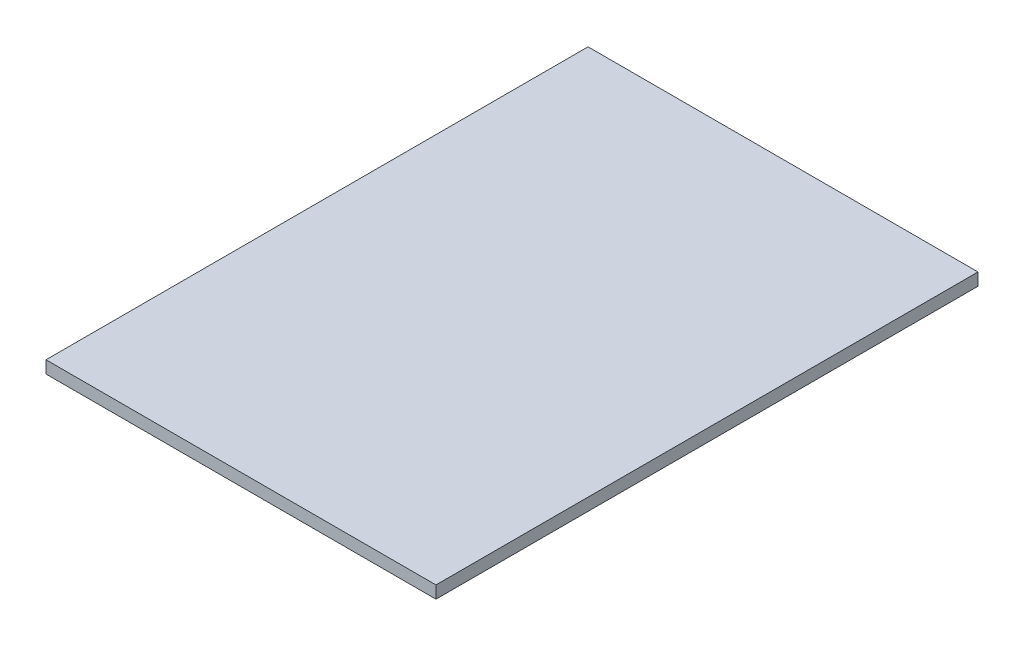
from build123d import *

# Parameters (mm, degrees)
SKETCH1_W           = 100
SKETCH1_H           = 3.175
BOSS_EXTRUDE1_DEPTH = 139


with BuildPart() as part:
    # Sketch1 → Boss-Extrude1 (new body)
    with BuildSketch(Plane.XY):
        with Locations((0, 71.699747591)):
            Rectangle(SKETCH1_W, SKETCH1_H)
    extrude(amount=-BOSS_EXTRUDE1_DEPTH)


solid = part.part
